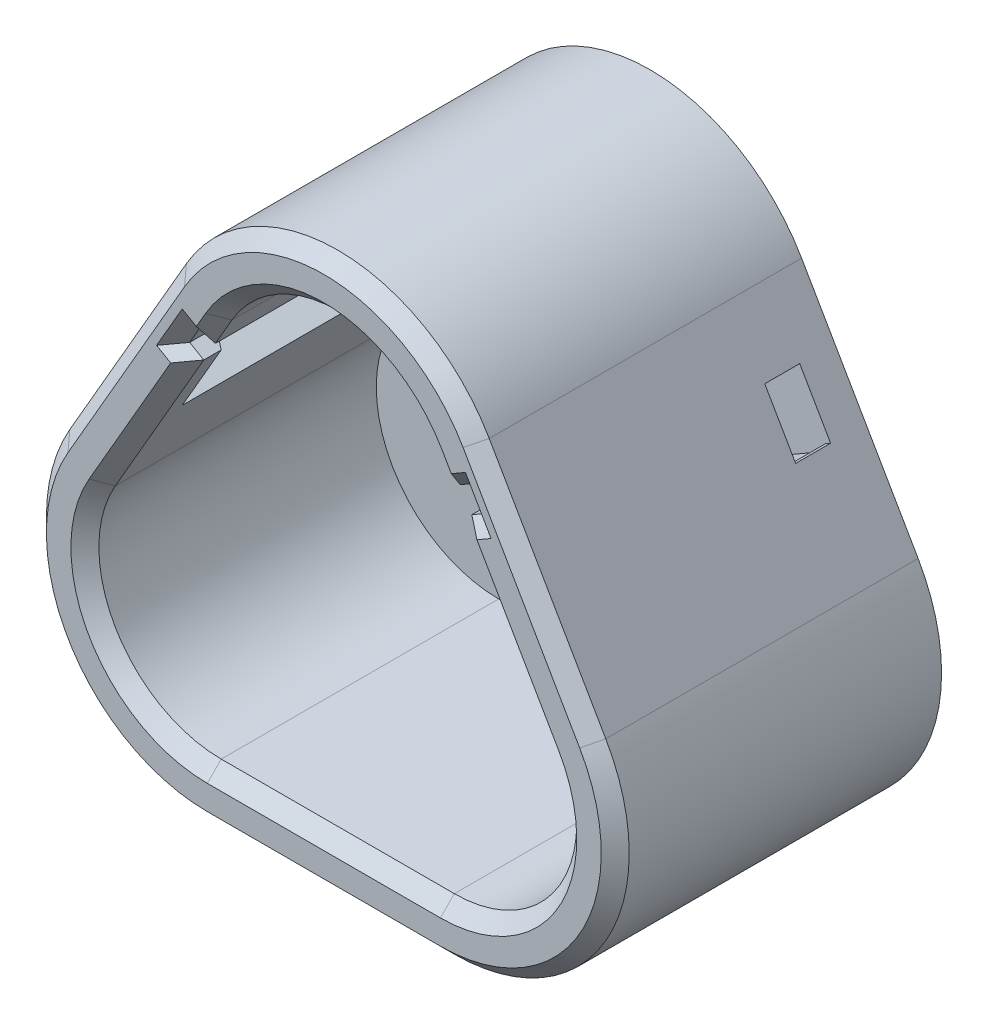
from build123d import *

# Parameters (mm, degrees)
BOSS_EXTRU_1_DEPTH      = 25
ENL_V_MAT_EXTRU_1_DEPTH = 20
ENL_V_MAT_EXTRU_2_DEPTH = 45.21248121115924
ENL_V_MAT_EXTRU_4_DEPTH = 20
ENL_V_MAT_EXTRU_3_DEPTH = 45.21248121115924
CHANFREIN1_SIZE         = 1.2
BOSS_EXTRU_2_START      = 3
BOSS_EXTRU_2_DEPTH      = 3
ENL_V_MAT_EXTRU_5_REACH = 47.001
ESQUISSE7_W             = 1.399999999999995
ESQUISSE7_H             = 20
CHANFREIN2_SIZE2        = 4
CHANFREIN2_SIZE         = 2.309401077
ENL_V_MAT_EXTRU_6_REACH = 60.237
CHANFREIN3_SIZE2        = 4
CHANFREIN3_SIZE         = 2.309401077


with BuildPart() as part:
    # Esquisse1 → Boss.-Extru.1 (new body)
    with BuildSketch(Plane.XY):
        with BuildLine():
            Line((-22.99038105676658, 1.7264973081037391), (-12.990381056766578, 19.047005383792516))
            ThreePointArc((-12.990381056766578, 19.047005383792516), (9.5e-16, 26.547005383792516), (12.990381056766578, 19.047005383792513))
            Line((12.990381056766578, 19.047005383792513), (22.990381056766577, 1.726497308103746))
            ThreePointArc((22.990381056766577, 1.726497308103746), (22.99038105676658, -13.273502691896258), (9.999999999999996, -20.77350269189626))
            Line((9.999999999999996, -20.77350269189626), (-10, -20.773502691896258))
            ThreePointArc((-10, -20.773502691896258), (-22.99038105676658, -13.273502691896255), (-22.99038105676658, 1.7264973081037391))
        make_face()
        with BuildLine():
            Line((-18.66025403784439, -0.7735026918962613), (-8.66025403784439, 16.547005383792516))
            ThreePointArc((-8.66025403784439, 16.547005383792516), (-2.69e-15, 21.547005383792516), (8.660254037844384, 16.547005383792516))
            Line((8.660254037844384, 16.547005383792516), (18.660254037844386, -0.7735026918962474))
            ThreePointArc((18.660254037844386, -0.7735026918962474), (18.660254037844393, -10.773502691896258), (10, -15.773502691896258))
            Line((10, -15.773502691896258), (-10, -15.773502691896258))
            ThreePointArc((-10, -15.773502691896258), (-18.66025403784439, -10.773502691896262), (-18.66025403784439, -0.7735026918962613))
        make_face(mode=Mode.SUBTRACT)
    extrude(amount=BOSS_EXTRU_1_DEPTH)

    # Esquisse2 → Enlèv. mat.-Extru.1 (cut)
    with BuildSketch(Plane.XY.offset(25)):
        Polygon((-10.914359353944898, 12.642780450695335), (-12.300000000000002, 13.442780450695334), (-11.600000000000003, 14.655216015993549), (-10.2143593539449, 13.855216015993548), align=None)
        Polygon((10.214359353944896, 13.855216015993548), (11.6, 14.655216015993549), (12.299999999999999, 13.442780450695334), (10.914359353944896, 12.642780450695334), align=None)
    extrude(amount=-ENL_V_MAT_EXTRU_1_DEPTH, mode=Mode.SUBTRACT)

    # Esquisse3 → Enlèv. mat.-Extru.2 (cut, through all)
    with BuildSketch(Plane.XY.offset(25)):
        Polygon((-10.064359353944898, 14.115023637128878), (-11.709807621135333, 15.06502363712888), (-12.709807621135335, 13.332972829560003), (-11.064359353944898, 12.382972829560003), align=None)
    enl_v_mat_extru_2 = extrude(amount=-ENL_V_MAT_EXTRU_2_DEPTH, mode=Mode.SUBTRACT)

    # Symétrie1: Enlèv. mat.-Extru.2 across plane
    add(enl_v_mat_extru_2.mirror(Plane(origin=(0, 0, 0), x_dir=(0, 0, 1), z_dir=(1, 0, 0))), mode=Mode.SUBTRACT)

    # Esquisse6 → Enlèv. mat.-Extru.4 (cut)
    with BuildSketch(Plane(origin=(0, 0, 0), x_dir=(-1, 0, 0), z_dir=(0, 0, -1))):
        Polygon((11.250000000000002, 12.061433798642659), (15.147114317029969, 14.31143379864266), (18.297114317029976, 8.855473754800698), (14.4, 6.605473754800695), align=None)
        Polygon((-11.249999999999998, 12.061433798642659), (-15.14711431702997, 14.311433798642657), (-18.297114317029973, 8.855473754800693), (-14.399999999999997, 6.605473754800696), align=None)
    extrude(amount=-ENL_V_MAT_EXTRU_4_DEPTH, mode=Mode.SUBTRACT)

    # Esquisse5 → Enlèv. mat.-Extru.3 (cut, through all)
    with BuildSketch(Plane.XY.offset(25)):
        with BuildLine():
            Line((-9.093266739736611, 16.797005383792516), (-10.497372055837118, 14.365023637128878))
            Line((-10.497372055837118, 14.365023637128878), (-11.497372055837118, 12.632972829560003))
            Line((-11.497372055837118, 12.632972829560003), (-19.093266739736613, -0.5235026918962613))
            ThreePointArc((-19.093266739736613, -0.5235026918962613), (-19.09326673973661, -11.023502691896262), (-10.000000000000002, -16.273502691896258))
            Line((-10.000000000000002, -16.273502691896258), (10.000000000000004, -16.273502691896258))
            ThreePointArc((10.000000000000004, -16.273502691896258), (19.09326673973661, -11.023502691896251), (19.093266739736602, -0.523502691896249))
            Line((19.093266739736602, -0.523502691896249), (11.497372055837113, 12.632972829560005))
            Line((11.497372055837113, 12.632972829560005), (10.497372055837118, 14.36502363712888))
            Line((10.497372055837118, 14.36502363712888), (9.0932667397366, 16.797005383792516))
            ThreePointArc((9.0932667397366, 16.797005383792516), (-2.66e-15, 22.047005383792516), (-9.093266739736611, 16.797005383792516))
        make_face()
        with BuildLine():
            Line((-8.66025403784439, 16.547005383792516), (-10.064359353944898, 14.115023637128878))
            Line((-10.064359353944898, 14.115023637128878), (-11.064359353944894, 12.382972829560005))
            Line((-11.064359353944894, 12.382972829560005), (-18.66025403784439, -0.7735026918962613))
            ThreePointArc((-18.66025403784439, -0.7735026918962613), (-18.66025403784439, -10.773502691896262), (-10, -15.773502691896258))
            Line((-10, -15.773502691896258), (10.000000000000002, -15.77350269189626))
            ThreePointArc((10.000000000000002, -15.77350269189626), (18.66025403784439, -10.773502691896255), (18.660254037844386, -0.7735026918962474))
            Line((18.660254037844386, -0.7735026918962474), (11.064359353944898, 12.382972829560003))
            Line((11.064359353944898, 12.382972829560003), (10.064359353944898, 14.115023637128878))
            Line((10.064359353944898, 14.115023637128878), (8.660254037844384, 16.547005383792516))
            ThreePointArc((8.660254037844384, 16.547005383792516), (-2.69e-15, 21.547005383792516), (-8.66025403784439, 16.547005383792516))
        make_face(mode=Mode.SUBTRACT)
    extrude(amount=-ENL_V_MAT_EXTRU_3_DEPTH, mode=Mode.SUBTRACT)

    # Chanfrein1
    chanfrein1_edges = [part.edges().sort_by_distance(p)[0] for p in [
        (22.99038105676658, -13.27350269189626, 25),
        (11.103589838486222, 14.715023637128876, 25),
        (-11.103589838486226, 14.71502363712888, 25),
        (-9.795319397786868, 15.581014510460694, 25),
        (9.795319397786855, 15.581014510460696, 25),
        (-7.11e-15, 22.047005383792516, 25),
        (-15.295319397786866, 6.054735068831872, 25),
        (-19.09326673973661, -11.023502691896262, 25),
        (1.78e-15, -16.273502691896258, 25),
        (19.093266739736606, -11.023502691896253, 25),
        (15.295319397786855, 6.054735068831873, 25),
        (17.990381056766577, 10.386751345948129, 25),
        (2.66e-15, 26.547005383792516, 25),
        (-17.99038105676658, 10.386751345948127, 25),
        (-22.99038105676658, -13.273502691896258, 25),
        (-12.209807621135333, 14.19899823334444, 25),
        (-12.103589838486226, 12.982972829560003, 25),
        (-1.78e-15, -20.77350269189626, 25),
        (12.209807621135335, 14.19899823334444, 25),
        (12.103589838486222, 12.982972829560001, 25),
    ]]
    chamfer(chanfrein1_edges, length=CHANFREIN1_SIZE)

    # Esquisse4 → Boss.-Extru.2 (add)
    with BuildSketch(Plane(origin=(0, 0, 0), x_dir=(-1, 0, 0), z_dir=(0, 0, -1)).offset(BOSS_EXTRU_2_START)):
        with BuildLine():
            Line((22.99038105676658, 1.7264973081037323), (12.990381056766578, 19.047005383792516))
            ThreePointArc((12.990381056766578, 19.047005383792516), (8.9e-16, 26.547005383792513), (-12.990381056766573, 19.047005383792513))
            Line((-12.990381056766573, 19.047005383792513), (-22.990381056766577, 1.726497308103746))
            ThreePointArc((-22.990381056766577, 1.726497308103746), (-22.99038105676658, -13.273502691896255), (-10.000000000000004, -20.773502691896258))
            Line((-10.000000000000004, -20.773502691896258), (9.999999999999996, -20.773502691896258))
            ThreePointArc((9.999999999999996, -20.773502691896258), (22.990381056766577, -13.273502691896262), (22.99038105676658, 1.7264973081037323))
        make_face()
    extrude(amount=-BOSS_EXTRU_2_DEPTH)

    # Esquisse7 → Enlèv. mat.-Extru.5 (cut, up to next)
    with BuildSketch(Plane(origin=(-2.5958946838994956, 4.496221483611885, 0), x_dir=(0.866025403784439, 0.4999999999999994, 0), z_dir=(-0.4999999999999994, 0.866025403784439, 0)), mode=Mode.PRIVATE) as enl_v_mat_extru_5_sk1:
        with Locations((16.973502691896265, -10)):
            Rectangle(ESQUISSE7_W, ESQUISSE7_H)
    enl_v_mat_extru_5_tool1 = extrude(enl_v_mat_extru_5_sk1.sketch, amount=-ENL_V_MAT_EXTRU_5_REACH, mode=Mode.PRIVATE) & part.part
    enl_v_mat_extru_5 = enl_v_mat_extru_5_tool1.solids().sort_by_distance((12.10359, 12.982973, 10))[0]
    add(enl_v_mat_extru_5, mode=Mode.SUBTRACT)

    # Symétrie2: Enlèv. mat.-Extru.5 across plane
    add(enl_v_mat_extru_5.mirror(Plane(origin=(0, 0, 0), x_dir=(0, 0, 1), z_dir=(1, 0, 0))), mode=Mode.SUBTRACT)

    # Chanfrein2
    chanfrein2_edges = [part.edges().sort_by_distance(p)[0] for p in [
        (13.16519237886467, 9.74422329218035, 20),
    ]]
    chanfrein2_side = [part.faces().sort_by_distance(p)[0] for p in [
        (13.16519237886467, 9.74422329218035, 20.04618802153517),
    ]]
    chamfer(chanfrein2_edges, length=CHANFREIN2_SIZE - 0.0001, length2=CHANFREIN2_SIZE2 - 0.0001, reference=chanfrein2_side[0])  # a hair under: the kernel refuses the full size

    # Esquisse8 → Enlèv. mat.-Extru.6 (cut, up to next)
    with BuildSketch(Plane(origin=(17.557368354874363, 10.13675134594814, 0), x_dir=(0, 0, 1), z_dir=(-0.8660254037844385, -0.5000000000000004, 0)), mode=Mode.PRIVATE) as enl_v_mat_extru_6_sk1:
        Polygon((3.0000000000000004, 4.320508075688777), (5.3e-16, 4.320508075688777), (8.7e-16, -0.9794919243112247), (3.000000000000001, -0.9794919243112244), align=None)
    enl_v_mat_extru_6_tool1 = extrude(enl_v_mat_extru_6_sk1.sketch, amount=-ENL_V_MAT_EXTRU_6_REACH, mode=Mode.PRIVATE) & part.part
    enl_v_mat_extru_6 = enl_v_mat_extru_6_tool1.solids().sort_by_distance((16.722114, 11.583454, 1.5))[0]
    add(enl_v_mat_extru_6, mode=Mode.SUBTRACT)

    # Symétrie3: Enlèv. mat.-Extru.6 across plane
    add(enl_v_mat_extru_6.mirror(Plane(origin=(0, 0, 0), x_dir=(0, 0, 1), z_dir=(1, 0, 0))), mode=Mode.SUBTRACT)

    # Chanfrein3
    chanfrein3_edges = [part.edges().sort_by_distance(p)[0] for p in [
        (-13.16519237886467, 9.74422329218035, 20),
    ]]
    chanfrein3_side = [part.faces().sort_by_distance(p)[0] for p in [
        (-13.16519237886467, 9.74422329218035, 20.04618802153517),
    ]]
    chamfer(chanfrein3_edges, length=CHANFREIN3_SIZE - 0.0001, length2=CHANFREIN3_SIZE2 - 0.0001, reference=chanfrein3_side[0])  # a hair under: the kernel refuses the full size

    # Esquisse10 → Fraisage pour vis à tête fraisée M51 (revolve, cut)
    with BuildSketch(Plane(origin=(0, 0, 0), x_dir=(0, -1, 0), z_dir=(1, 0, 0))):
        Polygon((0, 0), (-7.3e-16, 2.9999999999999996), (2.7499999999999996, 2.9999999999999996), (2.75, 2.449999999999999), (5.200000000000001, 0), align=None)
    revolve(axis=Axis((0, 0, 6.349999999999991), (0, 0, -1)), mode=Mode.SUBTRACT)


solid = part.part
